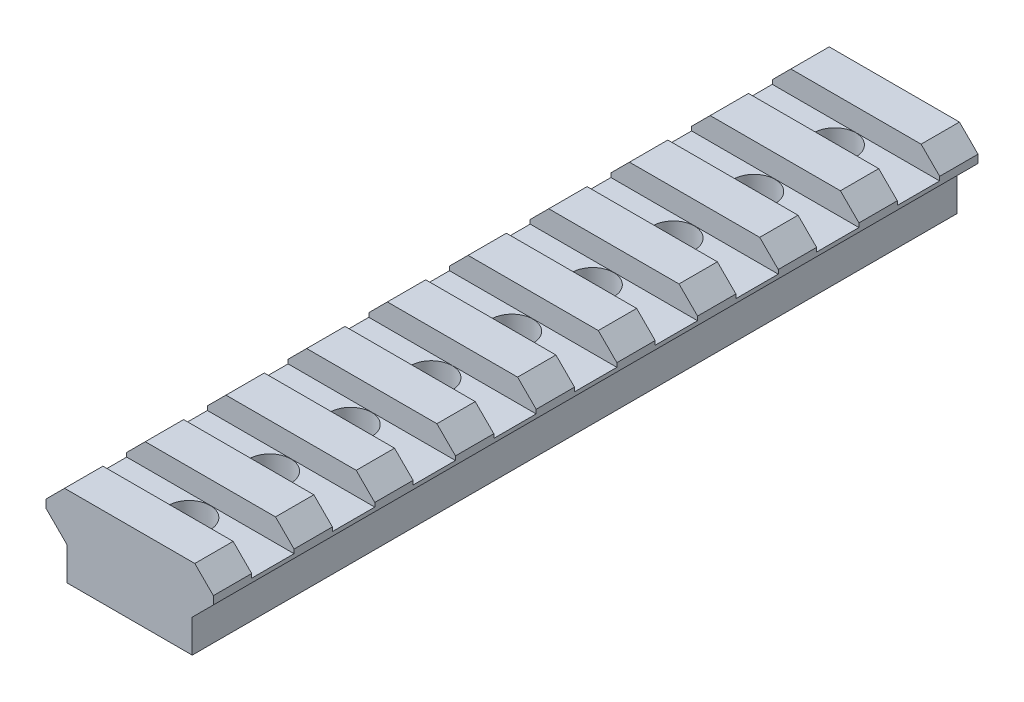
from build123d import *

# Parameters (mm, degrees)
DODANIE_WYCI_GNI_CIE2_DEPTH = 94.75
SZKIC2_W                    = 21.74
SZKIC2_H                    = 5.25
WYTNIJ_WYCI_GNI_CIE2_DEPTH  = 2.8
SZKIC3_R                    = 1.3
WYTNIJ_WYCI_GNI_CIE3_DEPTH  = 98.478357085
SZKIC4_R                    = 2.6
WYTNIJ_WYCI_GNI_CIE4_DEPTH  = 3.2
CUT_EXTRUDE1_DEPTH          = 98.478357085


with BuildPart() as part:
    # Szkic1 → Dodanie-wyciągnięcie2 (new body)
    with BuildSketch(Plane.XY):
        Polygon((2.8, 2.8), (0, 0), (3.12, -3.12), (3.12, -7.2), (18.62, -7.2), (18.62, -3.12), (21.74, 0), (18.94, 2.8), align=None)
    extrude(amount=DODANIE_WYCI_GNI_CIE2_DEPTH)

    # Szkic2 → Wytnij-wyciągnięcie2 (cut)
    with BuildSketch(Plane(origin=(0, 2.8, 0), x_dir=(1, 0, 0), z_dir=(0, 1, 0))):
        with Locations((10.87, -17.375)):
            Rectangle(SZKIC2_W, SZKIC2_H)
        with Locations((10.87, -7.375)):
            Rectangle(SZKIC2_W, SZKIC2_H)
        with Locations((10.87, -27.375)):
            Rectangle(SZKIC2_W, SZKIC2_H)
        with Locations((10.87, -37.375)):
            Rectangle(SZKIC2_W, SZKIC2_H)
        with Locations((10.87, -47.375)):
            Rectangle(SZKIC2_W, SZKIC2_H)
        with Locations((10.87, -57.375)):
            Rectangle(SZKIC2_W, SZKIC2_H)
        with Locations((10.87, -67.375)):
            Rectangle(SZKIC2_W, SZKIC2_H)
        with Locations((10.87, -77.375)):
            Rectangle(SZKIC2_W, SZKIC2_H)
        with Locations((10.87, -87.375)):
            Rectangle(SZKIC2_W, SZKIC2_H)
    extrude(amount=-WYTNIJ_WYCI_GNI_CIE2_DEPTH, mode=Mode.SUBTRACT)

    # Szkic3 → Wytnij-wyciągnięcie3 (cut, through all)
    with BuildSketch(Plane(origin=(0, 0, 0), x_dir=(1, 0, 0), z_dir=(0, 1, 0))):
        with Locations((10.87, -7.375)):
            Circle(SZKIC3_R)
        with Locations((10.87, -17.375)):
            Circle(SZKIC3_R)
        with Locations((10.87, -27.375)):
            Circle(SZKIC3_R)
        with Locations((10.87, -37.375)):
            Circle(SZKIC3_R)
        with Locations((10.87, -47.375)):
            Circle(SZKIC3_R)
        with Locations((10.87, -57.375)):
            Circle(SZKIC3_R)
        with Locations((10.87, -67.375)):
            Circle(SZKIC3_R)
        with Locations((10.87, -77.375)):
            Circle(SZKIC3_R)
        with Locations((10.87, -87.375)):
            Circle(SZKIC3_R)
    extrude(amount=-WYTNIJ_WYCI_GNI_CIE3_DEPTH, mode=Mode.SUBTRACT)

    # Szkic4 → Wytnij-wyciągnięcie4 (cut)
    with BuildSketch(Plane(origin=(0, 0, -1.86), x_dir=(1, 0, 0), z_dir=(0, -1, 0))):
        with Locations((10.87, 89.235)):
            Circle(SZKIC4_R)
        with Locations((10.87, 79.235)):
            Circle(SZKIC4_R)
        with Locations((10.87, 69.235)):
            Circle(SZKIC4_R)
        with Locations((10.87, 59.235)):
            Circle(SZKIC4_R)
        with Locations((10.87, 49.235)):
            Circle(SZKIC4_R)
        with Locations((10.87, 39.235)):
            Circle(SZKIC4_R)
        with Locations((10.87, 29.235)):
            Circle(SZKIC4_R)
        with Locations((10.87, 19.235)):
            Circle(SZKIC4_R)
        with Locations((10.87, 9.235)):
            Circle(SZKIC4_R)
    extrude(amount=WYTNIJ_WYCI_GNI_CIE4_DEPTH, mode=Mode.SUBTRACT)

    # Sketch1 → Cut-Extrude1 (cut, through all)
    with BuildSketch(Plane.XY.offset(94.75)):
        Polygon((0.5, 0.5), (0.5, -0.5), (0, 0), align=None)
        Polygon((21.24, 0.5), (21.24, -0.5), (21.74, 0), align=None)
    extrude(amount=-CUT_EXTRUDE1_DEPTH, mode=Mode.SUBTRACT)


solid = part.part
